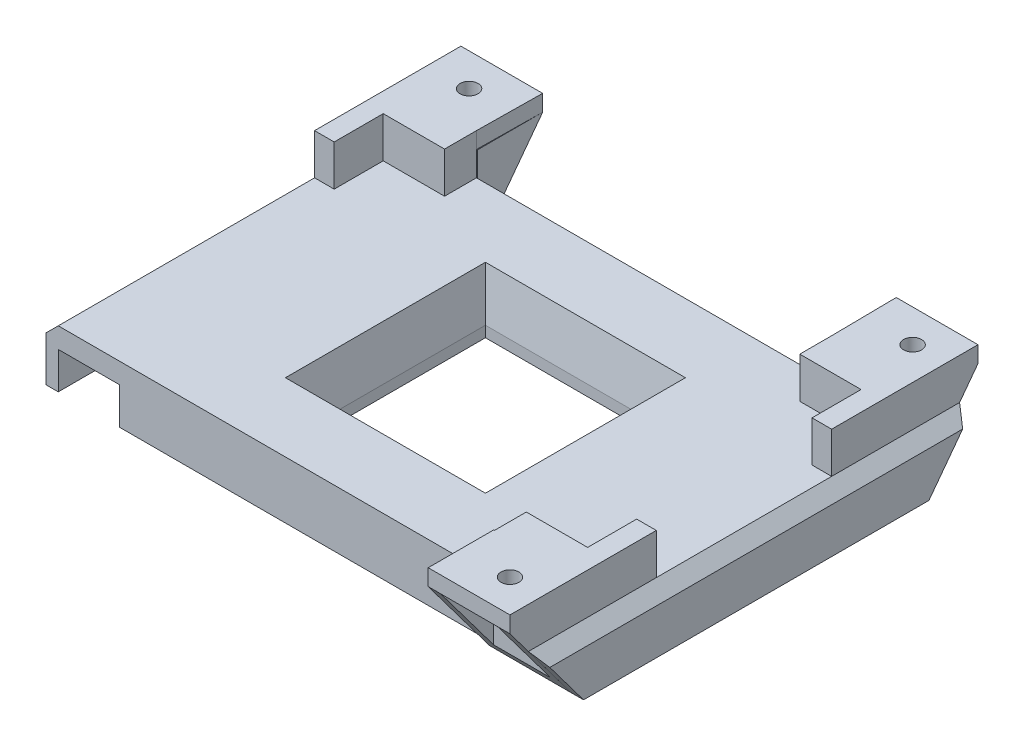
from build123d import *

# Parameters (mm, degrees)
SKETCH_1_W          = 44.92820323
SKETCH_1_H          = 44.928203231
EXTRUDE_1_DEPTH     = 9
SKETCH_2_W          = 126.5
SKETCH_2_H          = 82.5
SKETCH_2_W_2        = 44.92820323
SKETCH_2_H_2        = 44.928203231
EXTRUDE_2_DEPTH     = 5
CHAMFER_1_SIZE      = 2
CHAMFER_1_SIZE2     = 11.342563639
EXTRUDE_3_DEPTH     = 10
SKETCH_4_W          = 20
SKETCH_4_H          = 16
SKETCH_4_R          = 2.2
EXTRUDE_4_DEPTH     = 4
EXTRUDE_5_DEPTH     = 20
EXTRUDE_6_DEPTH     = 20
SKETCH_7_W          = 14
SKETCH_7_H          = 13
CUT_EXTRUDE_1_DEPTH = 20
EXTRUDE_7_DEPTH     = 3
EXTRUDE_8_DEPTH     = 3
CHAMFER_2_SIZE      = 3
SKETCH_10_W         = 1
SKETCH_10_H         = 16
SKETCH_10_H_2       = 15.995398116
CUT_EXTRUDE_2_DEPTH = 9


with BuildPart() as part:
    # Эскиз1 → Бобышка-Вытянуть1 (new body)
    with BuildSketch(Plane(origin=(0, 122.195974268, 0), x_dir=(1, 0, 0), z_dir=(0, 1, 0))):
        Polygon((16.558980694, -48.273129836), (16.558980694, -54.273129836), (7.558980694, -63.273129836), (1.558980694, -63.273129836), (1.558980694, -115.773129836), (7.558980694, -115.773129836), (16.558980694, -124.773129836), (16.558980694, -130.773129836), (113.058980694, -130.773129836), (113.058980694, -124.773129836), (122.058980694, -115.773129836), (128.058980694, -115.773129836), (128.058980694, -63.273129836), (122.058980694, -63.273129836), (113.058980694, -54.273129836), (113.058980694, -48.273129836), align=None)
        with Locations((64.808980694, -89.523129837)):
            Rectangle(SKETCH_1_W, SKETCH_1_H, mode=Mode.SUBTRACT)
    extrude(amount=EXTRUDE_1_DEPTH)

    # Эскиз2 → Бобышка-Вытянуть2 (add)
    with BuildSketch(Plane(origin=(0, 131.195974268, 0), x_dir=(1, 0, 0), z_dir=(0, 1, 0))):
        with Locations((64.808980694, -89.523129836)):
            Rectangle(SKETCH_2_W, SKETCH_2_H)
        with Locations((64.808980694, -89.523129837)):
            Rectangle(SKETCH_2_W_2, SKETCH_2_H_2, mode=Mode.SUBTRACT)
    extrude(amount=EXTRUDE_2_DEPTH)

    # Фаска1
    chamfer_1_edges = [part.edges().sort_by_distance(p)[0] for p in [
        (64.808980694, 136.195974268, 67.059028221),
        (42.344879079, 136.195974268, 89.523129836),
        (64.808980694, 136.195974268, 111.987231452),
        (87.273082309, 136.195974268, 89.523129836),
    ]]
    chamfer_1_side = [part.faces().sort_by_distance(p)[0] for p in [
        (64.808980694, 136.195974268, 49.78337816),
    ]]
    chamfer(chamfer_1_edges, length=CHAMFER_1_SIZE, length2=CHAMFER_1_SIZE2, reference=chamfer_1_side[0])

    # Эскиз3 → Бобышка-Вытянуть3 (add)
    with BuildSketch(Plane(origin=(0, 136.195974268, 0), x_dir=(1, 0, 0), z_dir=(0, 1, 0))):
        Polygon((128.058980694, -68.073129836), (128.058980694, -48.273129836), (108.258980694, -48.273129836), (108.258980694, -56.073129836), (123.258980694, -56.073129836), (123.258980694, -68.073129836), align=None)
        Polygon((21.358980694, -48.273129836), (1.558980694, -48.273129836), (1.558980694, -68.073129836), (6.358980694, -68.073129836), (6.358980694, -56.073129836), (21.358980694, -56.073129836), align=None)
        Polygon((128.058980694, -110.973129836), (128.058980694, -130.773129836), (108.258980694, -130.773129836), (108.258980694, -122.973129836), (123.258980694, -122.973129836), (123.258980694, -110.973129836), align=None)
    extrude(amount=EXTRUDE_3_DEPTH)

    # Эскиз4 → Бобышка-Вытянуть4 (add)
    # profile 1 of 3: a face of its own
    with BuildSketch(Plane(origin=(0, 146.195974268, 0), x_dir=(1, 0, 0), z_dir=(0, 1, 0))):
        with Locations((118.058980694, -138.773129836)):
            Rectangle(SKETCH_4_W, SKETCH_4_H)
        with Locations(Location((120.058980694, -138.773129836, 0), (0, 0, 180))):
            Circle(SKETCH_4_R, mode=Mode.SUBTRACT)
    # profile 2 of 3: a face of its own
    with BuildSketch(Plane(origin=(0, 146.195974268, 0), x_dir=(1, 0, 0), z_dir=(0, 1, 0))):
        Polygon((128.058980694, -48.273129836), (128.058980694, -32.273129836), (108.058980694, -32.273129836), (108.258980694, -48.273129836), align=None)
        with Locations(Location((120.058980694, -40.273129836, 0), (0, 0, 180))):
            Circle(SKETCH_4_R, mode=Mode.SUBTRACT)
    # profile 3 of 3: a face of its own
    with BuildSketch(Plane(origin=(0, 146.195974268, 0), x_dir=(1, 0, 0), z_dir=(0, 1, 0))):
        Polygon((1.558980694, -48.273129836), (1.558980694, -32.273129836), (21.558980694, -32.273129836), (21.358980694, -48.273129836), align=None)
        with Locations(Location((11.558980694, -40.273129836, 0), (0, 0, 180))):
            Circle(SKETCH_4_R, mode=Mode.SUBTRACT)
    extrude(amount=-EXTRUDE_4_DEPTH)

    # Эскиз5 → Бобышка-Вытянуть5 (add)
    with BuildSketch(Plane(origin=(128.058980694, 0, 0), x_dir=(0, 0, -1), z_dir=(1, 0, 0))):
        Polygon((-146.773129836, 142.195974268), (-130.773129836, 142.195974268), (-130.773129836, 131.195974268), (-131.773129836, 131.195974268), (-131.773129836, 122.195974268), align=None)
        Polygon((-32.273129836, 142.195974268), (-48.273129836, 142.195974268), (-48.273129836, 131.195974268), (-47.273129836, 131.195974268), (-47.273129836, 122.195974268), align=None)
    extrude(amount=-EXTRUDE_5_DEPTH)

    # Эскиз6 → Бобышка-Вытянуть6 (add)
    with BuildSketch(Plane.ZY.offset(-1.558980694)):
        Polygon((32.273129836, 142.195974268), (48.273129836, 142.195974268), (48.273129836, 131.195974268), (47.273129836, 131.195974268), (47.273129836, 122.195974268), align=None)
    extrude(amount=-EXTRUDE_6_DEPTH)

    # Эскиз7 → Вырез-Вытянуть1 (cut)
    with BuildSketch(Plane(origin=(0, 122.195974268, 0), x_dir=(-1, 0, 0), z_dir=(0, -1, 0))):
        with Locations((-11.558980694, -38.773129836)):
            Rectangle(SKETCH_7_W, SKETCH_7_H)
        with Locations((-118.058980694, -38.773129836)):
            Rectangle(SKETCH_7_W, SKETCH_7_H)
        with Locations((-118.058980694, -140.273129836)):
            Rectangle(SKETCH_7_W, SKETCH_7_H)
    extrude(amount=-CUT_EXTRUDE_1_DEPTH, mode=Mode.SUBTRACT)

    # Эскиз8 → Бобышка-Вытянуть7 (add)
    with BuildSketch(Plane(origin=(128.058980694, 0, 0), x_dir=(0, 0, -1), z_dir=(1, 0, 0))):
        Polygon((-142.273129836, 136.195974268), (-36.773129836, 136.195974268), (-47.273129836, 122.195974268), (-131.768527952, 122.195974268), align=None)
    extrude(amount=EXTRUDE_7_DEPTH)

    # Эскиз9 → Бобышка-Вытянуть8 (add)
    with BuildSketch(Plane.ZY.offset(-1.558980694)):
        Polygon((47.296106509, 122.195974268), (36.773129836, 136.195974268), (130.773129836, 136.195974268), (130.773129836, 122.195974268), align=None)
    extrude(amount=EXTRUDE_8_DEPTH)

    # Фаска2
    chamfer_2_edges = [part.edges().sort_by_distance(p)[0] for p in [
        (131.058980694, 136.195974268, 89.523129836),
        (-1.441019306, 136.195974268, 83.773129836),
    ]]
    chamfer(chamfer_2_edges, length=CHAMFER_2_SIZE - 0.0001)  # a hair under: the kernel refuses the full size

    # Эскиз10 → Вырез-Вытянуть2 (cut)
    with BuildSketch(Plane(origin=(0, 122.195974268, 0), x_dir=(-1, 0, 0), z_dir=(0, -1, 0))):
        with Locations((-128.558980694, -55.273129836)):
            Rectangle(SKETCH_10_W, SKETCH_10_H)
        with Locations((-128.558980694, -123.770828894)):
            Rectangle(SKETCH_10_W, SKETCH_10_H_2)
        Polygon((-1.558980694, -47.273129836), (-1.558980694, -63.273129836), (-0.558980694, -63.273129836), (-0.558980694, -47.296106509), align=None)
    extrude(amount=-CUT_EXTRUDE_2_DEPTH, mode=Mode.SUBTRACT)


solid = part.part
